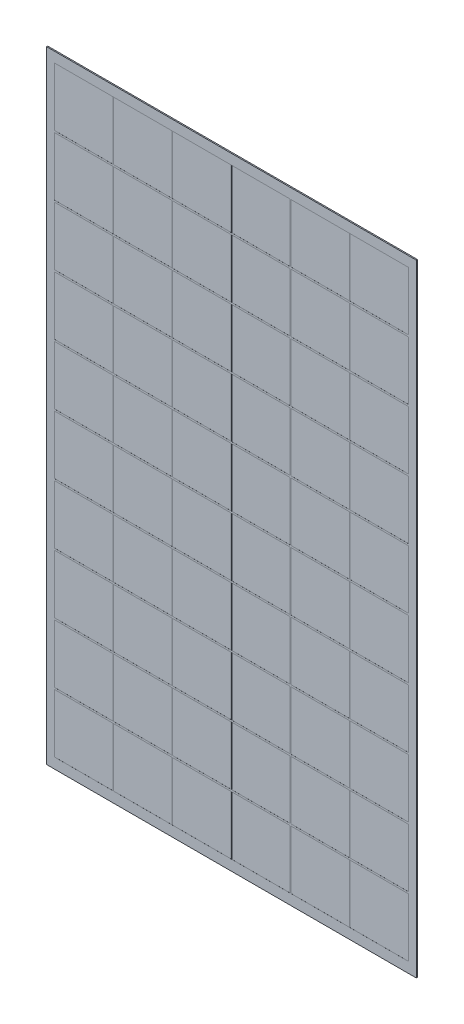
from build123d import *

# Parameters (mm, degrees)
SKETCH1_W           = 980
SKETCH1_H           = 1648
BOSS_EXTRUDE1_DEPTH = 3
SKETCH2_W           = 155
SKETCH2_H           = 155
CUT_EXTRUDE1_DEPTH  = 0.1
SKETCH3_W           = 75
SKETCH3_H           = 5
BOSS_EXTRUDE2_DEPTH = 0.5


with BuildPart() as part:
    # Sketch1 → Boss-Extrude1 (new body)
    with BuildSketch(Plane.XY):
        with Locations((490, 824)):
            Rectangle(SKETCH1_W, SKETCH1_H)
    extrude(amount=BOSS_EXTRUDE1_DEPTH)

    # Sketch2 → Cut-Extrude1 (cut)
    with BuildSketch(Plane.XY.offset(3)):
        with Locations((98.5, 1543.5)):
            Rectangle(SKETCH2_W, SKETCH2_H)
        with Locations((255.1, 1543.5)):
            Rectangle(SKETCH2_W, SKETCH2_H)
        with Locations((411.7, 1543.5)):
            Rectangle(SKETCH2_W, SKETCH2_H)
        with Locations((568.3, 1543.5)):
            Rectangle(SKETCH2_W, SKETCH2_H)
        with Locations((724.9, 1543.5)):
            Rectangle(SKETCH2_W, SKETCH2_H)
        with Locations((881.5, 1543.5)):
            Rectangle(SKETCH2_W, SKETCH2_H)
        with Locations((98.5, 1383.7)):
            Rectangle(SKETCH2_W, SKETCH2_H)
        with Locations((255.1, 1383.7)):
            Rectangle(SKETCH2_W, SKETCH2_H)
        with Locations((411.7, 1383.7)):
            Rectangle(SKETCH2_W, SKETCH2_H)
        with Locations((568.3, 1383.7)):
            Rectangle(SKETCH2_W, SKETCH2_H)
        with Locations((724.9, 1383.7)):
            Rectangle(SKETCH2_W, SKETCH2_H)
        with Locations((881.5, 1383.7)):
            Rectangle(SKETCH2_W, SKETCH2_H)
        with Locations((98.5, 1223.9)):
            Rectangle(SKETCH2_W, SKETCH2_H)
        with Locations((255.1, 1223.9)):
            Rectangle(SKETCH2_W, SKETCH2_H)
        with Locations((411.7, 1223.9)):
            Rectangle(SKETCH2_W, SKETCH2_H)
        with Locations((568.3, 1223.9)):
            Rectangle(SKETCH2_W, SKETCH2_H)
        with Locations((724.9, 1223.9)):
            Rectangle(SKETCH2_W, SKETCH2_H)
        with Locations((881.5, 1223.9)):
            Rectangle(SKETCH2_W, SKETCH2_H)
        with Locations((98.5, 1064.1)):
            Rectangle(SKETCH2_W, SKETCH2_H)
        with Locations((255.1, 1064.1)):
            Rectangle(SKETCH2_W, SKETCH2_H)
        with Locations((411.7, 1064.1)):
            Rectangle(SKETCH2_W, SKETCH2_H)
        with Locations((568.3, 1064.1)):
            Rectangle(SKETCH2_W, SKETCH2_H)
        with Locations((724.9, 1064.1)):
            Rectangle(SKETCH2_W, SKETCH2_H)
        with Locations((881.5, 1064.1)):
            Rectangle(SKETCH2_W, SKETCH2_H)
        with Locations((98.5, 904.3)):
            Rectangle(SKETCH2_W, SKETCH2_H)
        with Locations((255.1, 904.3)):
            Rectangle(SKETCH2_W, SKETCH2_H)
        with Locations((411.7, 904.3)):
            Rectangle(SKETCH2_W, SKETCH2_H)
        with Locations((568.3, 904.3)):
            Rectangle(SKETCH2_W, SKETCH2_H)
        with Locations((724.9, 904.3)):
            Rectangle(SKETCH2_W, SKETCH2_H)
        with Locations((881.5, 904.3)):
            Rectangle(SKETCH2_W, SKETCH2_H)
        with Locations((98.5, 744.5)):
            Rectangle(SKETCH2_W, SKETCH2_H)
        with Locations((255.1, 744.5)):
            Rectangle(SKETCH2_W, SKETCH2_H)
        with Locations((411.7, 744.5)):
            Rectangle(SKETCH2_W, SKETCH2_H)
        with Locations((568.3, 744.5)):
            Rectangle(SKETCH2_W, SKETCH2_H)
        with Locations((724.9, 744.5)):
            Rectangle(SKETCH2_W, SKETCH2_H)
        with Locations((881.5, 744.5)):
            Rectangle(SKETCH2_W, SKETCH2_H)
        with Locations((98.5, 584.7)):
            Rectangle(SKETCH2_W, SKETCH2_H)
        with Locations((255.1, 584.7)):
            Rectangle(SKETCH2_W, SKETCH2_H)
        with Locations((411.7, 584.7)):
            Rectangle(SKETCH2_W, SKETCH2_H)
        with Locations((568.3, 584.7)):
            Rectangle(SKETCH2_W, SKETCH2_H)
        with Locations((724.9, 584.7)):
            Rectangle(SKETCH2_W, SKETCH2_H)
        with Locations((881.5, 584.7)):
            Rectangle(SKETCH2_W, SKETCH2_H)
        with Locations((98.5, 424.9)):
            Rectangle(SKETCH2_W, SKETCH2_H)
        with Locations((255.1, 424.9)):
            Rectangle(SKETCH2_W, SKETCH2_H)
        with Locations((411.7, 424.9)):
            Rectangle(SKETCH2_W, SKETCH2_H)
        with Locations((568.3, 424.9)):
            Rectangle(SKETCH2_W, SKETCH2_H)
        with Locations((724.9, 424.9)):
            Rectangle(SKETCH2_W, SKETCH2_H)
        with Locations((881.5, 424.9)):
            Rectangle(SKETCH2_W, SKETCH2_H)
        with Locations((98.5, 265.1)):
            Rectangle(SKETCH2_W, SKETCH2_H)
        with Locations((255.1, 265.1)):
            Rectangle(SKETCH2_W, SKETCH2_H)
        with Locations((411.7, 265.1)):
            Rectangle(SKETCH2_W, SKETCH2_H)
        with Locations((568.3, 265.1)):
            Rectangle(SKETCH2_W, SKETCH2_H)
        with Locations((724.9, 265.1)):
            Rectangle(SKETCH2_W, SKETCH2_H)
        with Locations((881.5, 265.1)):
            Rectangle(SKETCH2_W, SKETCH2_H)
        with Locations((98.5, 105.3)):
            Rectangle(SKETCH2_W, SKETCH2_H)
        with Locations((255.1, 105.3)):
            Rectangle(SKETCH2_W, SKETCH2_H)
        with Locations((411.7, 105.3)):
            Rectangle(SKETCH2_W, SKETCH2_H)
        with Locations((568.3, 105.3)):
            Rectangle(SKETCH2_W, SKETCH2_H)
        with Locations((724.9, 105.3)):
            Rectangle(SKETCH2_W, SKETCH2_H)
        with Locations((881.5, 105.3)):
            Rectangle(SKETCH2_W, SKETCH2_H)
    extrude(amount=-CUT_EXTRUDE1_DEPTH, mode=Mode.SUBTRACT)

    # Sketch3 → Boss-Extrude2 (add)
    with BuildSketch(Plane(origin=(0, 0, 0), x_dir=(-1, 0, 0), z_dir=(0, 0, -1))):
        with Locations((-103.5, 1614.5)):
            Rectangle(SKETCH3_W, SKETCH3_H)
        with Locations((-103.5, 1454.5)):
            Rectangle(SKETCH3_W, SKETCH3_H)
        with Locations((-103.5, 1469.5)):
            Rectangle(SKETCH3_W, SKETCH3_H)
        with Locations((-103.5, 1309.5)):
            Rectangle(SKETCH3_W, SKETCH3_H)
        with Locations((-103.5, 1294.5)):
            Rectangle(SKETCH3_W, SKETCH3_H)
        with Locations((-103.5, 1149.5)):
            Rectangle(SKETCH3_W, SKETCH3_H)
        with Locations((-103.5, 1134.5)):
            Rectangle(SKETCH3_W, SKETCH3_H)
        with Locations((-103.5, 989.5)):
            Rectangle(SKETCH3_W, SKETCH3_H)
        with Locations((-103.5, 974.5)):
            Rectangle(SKETCH3_W, SKETCH3_H)
        with Locations((-103.5, 829.5)):
            Rectangle(SKETCH3_W, SKETCH3_H)
        with Locations((-103.5, 814.5)):
            Rectangle(SKETCH3_W, SKETCH3_H)
        with Locations((-103.5, 669.5)):
            Rectangle(SKETCH3_W, SKETCH3_H)
        with Locations((-103.5, 654.5)):
            Rectangle(SKETCH3_W, SKETCH3_H)
        with Locations((-103.5, 509.5)):
            Rectangle(SKETCH3_W, SKETCH3_H)
        with Locations((-103.5, 494.5)):
            Rectangle(SKETCH3_W, SKETCH3_H)
        with Locations((-103.5, 349.5)):
            Rectangle(SKETCH3_W, SKETCH3_H)
        with Locations((-103.5, 334.5)):
            Rectangle(SKETCH3_W, SKETCH3_H)
        with Locations((-103.5, 189.5)):
            Rectangle(SKETCH3_W, SKETCH3_H)
        with Locations((-103.5, 174.5)):
            Rectangle(SKETCH3_W, SKETCH3_H)
        with Locations((-103.5, 29.5)):
            Rectangle(SKETCH3_W, SKETCH3_H)
        with Locations((-258.5, 1614.5)):
            Rectangle(SKETCH3_W, SKETCH3_H)
        with Locations((-258.5, 1469.5)):
            Rectangle(SKETCH3_W, SKETCH3_H)
        with Locations((-258.5, 1454.5)):
            Rectangle(SKETCH3_W, SKETCH3_H)
        with Locations((-258.5, 1309.5)):
            Rectangle(SKETCH3_W, SKETCH3_H)
        with Locations((-258.5, 1294.5)):
            Rectangle(SKETCH3_W, SKETCH3_H)
        with Locations((-258.5, 1149.5)):
            Rectangle(SKETCH3_W, SKETCH3_H)
        with Locations((-258.5, 1134.5)):
            Rectangle(SKETCH3_W, SKETCH3_H)
        with Locations((-258.5, 989.5)):
            Rectangle(SKETCH3_W, SKETCH3_H)
        with Locations((-258.5, 974.5)):
            Rectangle(SKETCH3_W, SKETCH3_H)
        with Locations((-258.5, 829.5)):
            Rectangle(SKETCH3_W, SKETCH3_H)
        with Locations((-258.5, 814.5)):
            Rectangle(SKETCH3_W, SKETCH3_H)
        with Locations((-258.5, 669.5)):
            Rectangle(SKETCH3_W, SKETCH3_H)
        with Locations((-258.5, 654.5)):
            Rectangle(SKETCH3_W, SKETCH3_H)
        with Locations((-258.5, 509.5)):
            Rectangle(SKETCH3_W, SKETCH3_H)
        with Locations((-258.5, 494.5)):
            Rectangle(SKETCH3_W, SKETCH3_H)
        with Locations((-258.5, 349.5)):
            Rectangle(SKETCH3_W, SKETCH3_H)
        with Locations((-258.5, 334.5)):
            Rectangle(SKETCH3_W, SKETCH3_H)
        with Locations((-258.5, 189.5)):
            Rectangle(SKETCH3_W, SKETCH3_H)
        with Locations((-258.5, 174.5)):
            Rectangle(SKETCH3_W, SKETCH3_H)
        with Locations((-258.5, 29.5)):
            Rectangle(SKETCH3_W, SKETCH3_H)
        with Locations((-413.5, 1614.5)):
            Rectangle(SKETCH3_W, SKETCH3_H)
        with Locations((-413.5, 1469.5)):
            Rectangle(SKETCH3_W, SKETCH3_H)
        with Locations((-413.5, 1454.5)):
            Rectangle(SKETCH3_W, SKETCH3_H)
        with Locations((-413.5, 1309.5)):
            Rectangle(SKETCH3_W, SKETCH3_H)
        with Locations((-413.5, 1294.5)):
            Rectangle(SKETCH3_W, SKETCH3_H)
        with Locations((-413.5, 1149.5)):
            Rectangle(SKETCH3_W, SKETCH3_H)
        with Locations((-413.5, 1134.5)):
            Rectangle(SKETCH3_W, SKETCH3_H)
        with Locations((-413.5, 989.5)):
            Rectangle(SKETCH3_W, SKETCH3_H)
        with Locations((-413.5, 974.5)):
            Rectangle(SKETCH3_W, SKETCH3_H)
        with Locations((-413.5, 829.5)):
            Rectangle(SKETCH3_W, SKETCH3_H)
        with Locations((-413.5, 814.5)):
            Rectangle(SKETCH3_W, SKETCH3_H)
        with Locations((-413.5, 669.5)):
            Rectangle(SKETCH3_W, SKETCH3_H)
        with Locations((-413.5, 654.5)):
            Rectangle(SKETCH3_W, SKETCH3_H)
        with Locations((-413.5, 509.5)):
            Rectangle(SKETCH3_W, SKETCH3_H)
        with Locations((-413.5, 494.5)):
            Rectangle(SKETCH3_W, SKETCH3_H)
        with Locations((-413.5, 349.5)):
            Rectangle(SKETCH3_W, SKETCH3_H)
        with Locations((-413.5, 334.5)):
            Rectangle(SKETCH3_W, SKETCH3_H)
        with Locations((-413.5, 189.5)):
            Rectangle(SKETCH3_W, SKETCH3_H)
        with Locations((-413.5, 174.5)):
            Rectangle(SKETCH3_W, SKETCH3_H)
        with Locations((-413.5, 29.5)):
            Rectangle(SKETCH3_W, SKETCH3_H)
        with Locations((-568.5, 1614.5)):
            Rectangle(SKETCH3_W, SKETCH3_H)
        with Locations((-568.5, 1469.5)):
            Rectangle(SKETCH3_W, SKETCH3_H)
        with Locations((-568.5, 1454.5)):
            Rectangle(SKETCH3_W, SKETCH3_H)
        with Locations((-568.5, 1309.5)):
            Rectangle(SKETCH3_W, SKETCH3_H)
        with Locations((-568.5, 1294.5)):
            Rectangle(SKETCH3_W, SKETCH3_H)
        with Locations((-568.5, 1149.5)):
            Rectangle(SKETCH3_W, SKETCH3_H)
        with Locations((-568.5, 1134.5)):
            Rectangle(SKETCH3_W, SKETCH3_H)
        with Locations((-568.5, 989.5)):
            Rectangle(SKETCH3_W, SKETCH3_H)
        with Locations((-568.5, 974.5)):
            Rectangle(SKETCH3_W, SKETCH3_H)
        with Locations((-568.5, 829.5)):
            Rectangle(SKETCH3_W, SKETCH3_H)
        with Locations((-568.5, 814.5)):
            Rectangle(SKETCH3_W, SKETCH3_H)
        with Locations((-568.5, 669.5)):
            Rectangle(SKETCH3_W, SKETCH3_H)
        with Locations((-568.5, 654.5)):
            Rectangle(SKETCH3_W, SKETCH3_H)
        with Locations((-568.5, 509.5)):
            Rectangle(SKETCH3_W, SKETCH3_H)
        with Locations((-568.5, 494.5)):
            Rectangle(SKETCH3_W, SKETCH3_H)
        with Locations((-568.5, 349.5)):
            Rectangle(SKETCH3_W, SKETCH3_H)
        with Locations((-568.5, 334.5)):
            Rectangle(SKETCH3_W, SKETCH3_H)
        with Locations((-568.5, 189.5)):
            Rectangle(SKETCH3_W, SKETCH3_H)
        with Locations((-568.5, 174.5)):
            Rectangle(SKETCH3_W, SKETCH3_H)
        with Locations((-568.5, 29.5)):
            Rectangle(SKETCH3_W, SKETCH3_H)
        with Locations((-723.5, 1614.5)):
            Rectangle(SKETCH3_W, SKETCH3_H)
        with Locations((-723.5, 1469.5)):
            Rectangle(SKETCH3_W, SKETCH3_H)
        with Locations((-723.5, 1454.5)):
            Rectangle(SKETCH3_W, SKETCH3_H)
        with Locations((-723.5, 1309.5)):
            Rectangle(SKETCH3_W, SKETCH3_H)
        with Locations((-723.5, 1294.5)):
            Rectangle(SKETCH3_W, SKETCH3_H)
        with Locations((-723.5, 1149.5)):
            Rectangle(SKETCH3_W, SKETCH3_H)
        with Locations((-723.5, 1134.5)):
            Rectangle(SKETCH3_W, SKETCH3_H)
        with Locations((-723.5, 989.5)):
            Rectangle(SKETCH3_W, SKETCH3_H)
        with Locations((-723.5, 974.5)):
            Rectangle(SKETCH3_W, SKETCH3_H)
        with Locations((-723.5, 829.5)):
            Rectangle(SKETCH3_W, SKETCH3_H)
        with Locations((-723.5, 814.5)):
            Rectangle(SKETCH3_W, SKETCH3_H)
        with Locations((-723.5, 669.5)):
            Rectangle(SKETCH3_W, SKETCH3_H)
        with Locations((-723.5, 654.5)):
            Rectangle(SKETCH3_W, SKETCH3_H)
        with Locations((-723.5, 509.5)):
            Rectangle(SKETCH3_W, SKETCH3_H)
        with Locations((-723.5, 494.5)):
            Rectangle(SKETCH3_W, SKETCH3_H)
        with Locations((-723.5, 349.5)):
            Rectangle(SKETCH3_W, SKETCH3_H)
        with Locations((-723.5, 334.5)):
            Rectangle(SKETCH3_W, SKETCH3_H)
        with Locations((-723.5, 189.5)):
            Rectangle(SKETCH3_W, SKETCH3_H)
        with Locations((-723.5, 174.5)):
            Rectangle(SKETCH3_W, SKETCH3_H)
        with Locations((-723.5, 29.5)):
            Rectangle(SKETCH3_W, SKETCH3_H)
        with Locations((-878.5, 1614.5)):
            Rectangle(SKETCH3_W, SKETCH3_H)
        with Locations((-878.5, 1469.5)):
            Rectangle(SKETCH3_W, SKETCH3_H)
        with Locations((-878.5, 1454.5)):
            Rectangle(SKETCH3_W, SKETCH3_H)
        with Locations((-878.5, 1309.5)):
            Rectangle(SKETCH3_W, SKETCH3_H)
        with Locations((-878.5, 1294.5)):
            Rectangle(SKETCH3_W, SKETCH3_H)
        with Locations((-878.5, 1149.5)):
            Rectangle(SKETCH3_W, SKETCH3_H)
        with Locations((-878.5, 1134.5)):
            Rectangle(SKETCH3_W, SKETCH3_H)
        with Locations((-878.5, 989.5)):
            Rectangle(SKETCH3_W, SKETCH3_H)
        with Locations((-878.5, 974.5)):
            Rectangle(SKETCH3_W, SKETCH3_H)
        with Locations((-878.5, 829.5)):
            Rectangle(SKETCH3_W, SKETCH3_H)
        with Locations((-878.5, 814.5)):
            Rectangle(SKETCH3_W, SKETCH3_H)
        with Locations((-878.5, 669.5)):
            Rectangle(SKETCH3_W, SKETCH3_H)
        with Locations((-878.5, 654.5)):
            Rectangle(SKETCH3_W, SKETCH3_H)
        with Locations((-878.5, 509.5)):
            Rectangle(SKETCH3_W, SKETCH3_H)
        with Locations((-878.5, 494.5)):
            Rectangle(SKETCH3_W, SKETCH3_H)
        with Locations((-878.5, 349.5)):
            Rectangle(SKETCH3_W, SKETCH3_H)
        with Locations((-878.5, 334.5)):
            Rectangle(SKETCH3_W, SKETCH3_H)
        with Locations((-878.5, 189.5)):
            Rectangle(SKETCH3_W, SKETCH3_H)
        with Locations((-878.5, 174.5)):
            Rectangle(SKETCH3_W, SKETCH3_H)
        with Locations((-878.5, 29.5)):
            Rectangle(SKETCH3_W, SKETCH3_H)
    extrude(amount=BOSS_EXTRUDE2_DEPTH)


solid = part.part
